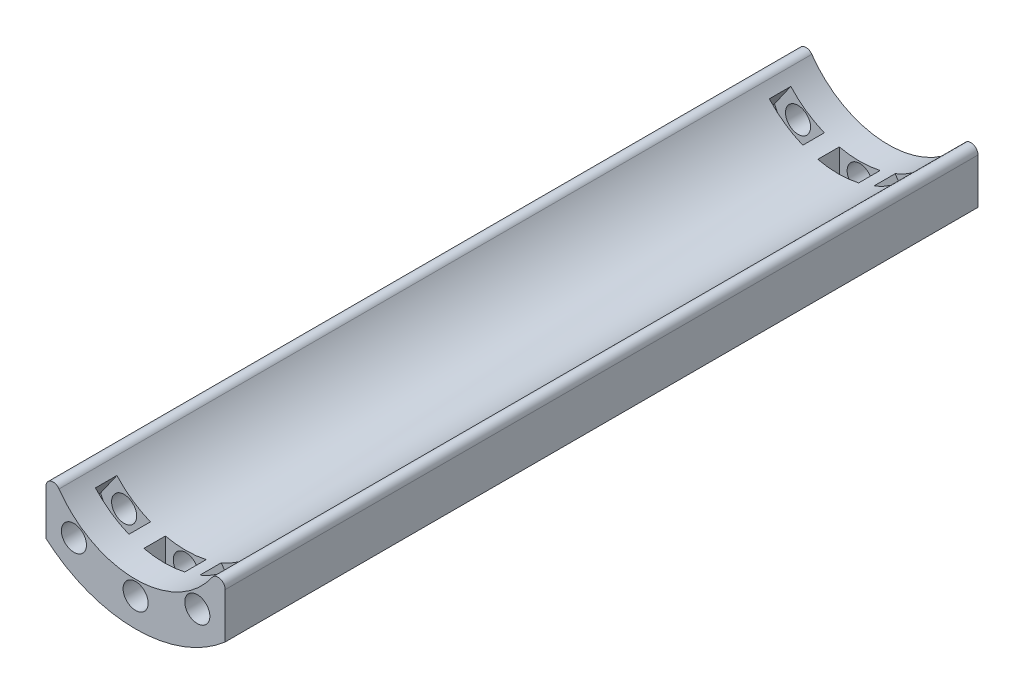
from build123d import *

# Parameters (mm, degrees)
BOSS_EXTRUDE1_DEPTH    = 105
SKETCH3_R              = 1.75
CUT_EXTRUDE1_DEPTH     = 15
CUT_EXTRUDE2_START     = -3
CUT_EXTRUDE2_OUTLINE_R = 1.75
CUT_EXTRUDE2_DEPTH     = 3
FILLET1_R              = 1


# Read off the part's stored shape, not the designer's step: Cut-Extrude2
with BuildPart() as part:
    # Sketch1 → Boss-Extrude1 (new body)
    with BuildSketch(Plane.XY):
        with BuildLine():
            ThreePointArc((-43.375, -14.309088021), (-30.875, -19), (-18.375, -14.309088021))
            Line((-18.375, -14.309088021), (-18.375, -3.570714214))
            ThreePointArc((-18.375, -3.570714214), (-30.875, -13), (-43.375, -3.570714214))
            Line((-43.375, -3.570714214), (-43.375, -14.309088021))
        make_face()
    extrude(amount=BOSS_EXTRUDE1_DEPTH)

    # Sketch3 → Cut-Extrude1 (cut)
    with BuildSketch(Plane(origin=(0, 0, 0), x_dir=(-1, 0, 0), z_dir=(0, 0, -1))):
        with Locations((22.271353455, -12.287280664)):
            Circle(SKETCH3_R)
        with Locations((30.875, -15)):
            Circle(SKETCH3_R)
        with Locations((39.478646545, -12.287280664)):
            Circle(SKETCH3_R)
    cut_extrude1 = extrude(amount=-CUT_EXTRUDE1_DEPTH, mode=Mode.SUBTRACT)

    # Cut-Extrude2 outline → Cut-Extrude2 (cut)
    # profile 1 of 3: a face of its own
    with BuildSketch(Plane(origin=(0, 0, 4), x_dir=(-1, 0, 0), z_dir=(0, 0, -1)).offset(CUT_EXTRUDE2_START)):
        with BuildLine():
            Line((20.383772748, -14.983025288), (23.662146428, -15.26984582))
            Line((23.662146428, -15.26984582), (25.93448352, -12.024612131))
            ThreePointArc((25.93448352, -12.024612131), (23.418506327, -10.648976576), (21.265316867, -8.755226444))
            Line((21.265316867, -8.755226444), (18.992979775, -12.000460133))
            Line((18.992979775, -12.000460133), (20.383772748, -14.983025288))
        make_face()
        with Locations((22.271353455, -12.287280664)):
            Circle(CUT_EXTRUDE2_OUTLINE_R, mode=Mode.SUBTRACT)
    # profile 2 of 3: a face of its own
    with BuildSketch(Plane(origin=(0, 0, 4), x_dir=(-1, 0, 0), z_dir=(0, 0, -1)).offset(CUT_EXTRUDE2_START)):
        with BuildLine():
            ThreePointArc((40.484683133, -8.755226444), (38.331493673, -10.648976576), (35.81551648, -12.024612131))
            Line((35.81551648, -12.024612131), (38.087853572, -15.26984582))
            Line((38.087853572, -15.26984582), (41.366227252, -14.983025288))
            Line((41.366227252, -14.983025288), (42.757020225, -12.000460133))
            Line((42.757020225, -12.000460133), (40.484683133, -8.755226444))
        make_face()
        with Locations((39.478646545, -12.287280664)):
            Circle(CUT_EXTRUDE2_OUTLINE_R, mode=Mode.SUBTRACT)
    # profile 3 of 3: a face of its own
    with BuildSketch(Plane(origin=(0, 0, 4), x_dir=(-1, 0, 0), z_dir=(0, 0, -1)).offset(CUT_EXTRUDE2_START)):
        with BuildLine():
            ThreePointArc((33.725, -12.683749446), (30.875, -13), (28.025, -12.683749446))
            Line((28.025, -12.683749446), (28.025, -16.645448267))
            Line((28.025, -16.645448267), (30.875, -18.290896534))
            Line((30.875, -18.290896534), (33.725, -16.645448267))
            Line((33.725, -16.645448267), (33.725, -12.683749446))
        make_face()
        with Locations((30.875, -15)):
            Circle(CUT_EXTRUDE2_OUTLINE_R, mode=Mode.SUBTRACT)
    cut_extrude2 = extrude(amount=CUT_EXTRUDE2_DEPTH, mode=Mode.SUBTRACT)

    # Mirror1: Cut-Extrude1, Cut-Extrude2 across plane
    add(cut_extrude1.mirror(Plane(origin=(0, 0, 52.5), x_dir=(1, 0, 0), z_dir=(0, 0, -1))), mode=Mode.SUBTRACT)
    add(cut_extrude2.mirror(Plane(origin=(0, 0, 52.5), x_dir=(1, 0, 0), z_dir=(0, 0, -1))), mode=Mode.SUBTRACT)

    # Fillet1
    fillet1_edges = [part.edges().sort_by_distance(p)[0] for p in [
        (-18.375, -3.570714214, 52.5),
        (-43.375, -3.570714214, 52.5),
    ]]
    fillet(fillet1_edges, radius=FILLET1_R)


solid = part.part
